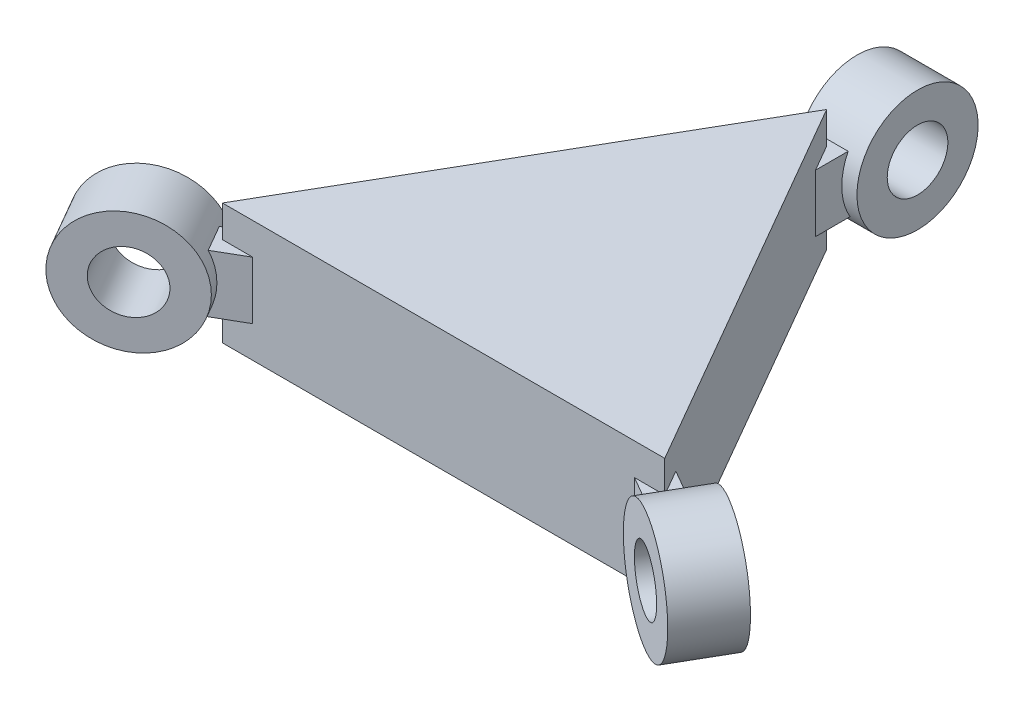
from build123d import *

# Parameters (mm, degrees)
BOSS_EXTRUDE1_DEPTH      = 20
BOSS_EXTRUDE2_DEPTH      = 5
BOSS_EXTRUDE2_DEPTH_BACK = 5
SKETCH3_R                = 10
SKETCH3_R_2              = 5
BOSS_EXTRUDE3_DEPTH      = 2.5
BOSS_EXTRUDE3_DEPTH_BACK = 2.5
SKETCH4_W                = 9.507770028
SKETCH4_H                = 1.347875139
MOVE_FACE1_BY            = 11.3
BODY_MOVE_COPY2_ANGLE    = 60
BODY_MOVE_COPY3_ANGLE    = 180


with BuildPart() as part:
    # Sketch1 → Boss-Extrude1 (new body)
    with BuildSketch(Plane(origin=(0, 0, 0), x_dir=(1, 0, 0), z_dir=(0, 1, 0))):
        Polygon((-36.5, 6.780145524), (36.5, 6.780145524), (0, 70), align=None)
    extrude(amount=BOSS_EXTRUDE1_DEPTH)


with BuildPart() as body_2:
    # Sketch3 → Boss-Extrude2 (new, two sides: drawn at the far end of the back side and taken through both)
    with BuildSketch(Plane(origin=(0, 0, 0), x_dir=(0, -1, 0), z_dir=(-1, 0, 0)).offset(-BOSS_EXTRUDE2_DEPTH_BACK)):
        with Locations(Location((-10.287349531, -80, 0), (0, 0, 90))):
            Circle(SKETCH3_R)
        with Locations(Location((-10.287349531, -80, 0), (0, 0, 90))):
            Circle(SKETCH3_R_2, mode=Mode.SUBTRACT)
    extrude(amount=BOSS_EXTRUDE2_DEPTH + BOSS_EXTRUDE2_DEPTH_BACK)

    # Sketch4 → Boss-Extrude3 (add, two sides: drawn at the far end of the back side and taken through both)
    with BuildSketch(Plane(origin=(0, 0, 0), x_dir=(0, -1, 0), z_dir=(-1, 0, 0)).offset(-BOSS_EXTRUDE3_DEPTH_BACK)):
        with Locations((-10, -70.673937569)):
            Rectangle(SKETCH4_W, SKETCH4_H)
    extrude(amount=BOSS_EXTRUDE3_DEPTH + BOSS_EXTRUDE3_DEPTH_BACK)

    # Move Face1: a face moved outward by 11.3
    extrude(body_2.faces().sort_by_distance((0, 10, -70))[0], amount=MOVE_FACE1_BY, dir=(0, 0, 1))


with BuildPart() as body_3:
    # Body-Move/Copy1: copy of body 2
    add(body_2.part.moved(Location((50, 0, 0))))


with BuildPart() as body_3_1:
    # Body-Move/Copy2: read off the stored shape, not the designer's step
    # Body-Move/Copy2: moved
    add(body_3.part.moved(Location((-25.8782217, 0, 45.4663337))).rotate(Axis((0, 0, 0), (0, 1, 0)), BODY_MOVE_COPY2_ANGLE))


with BuildPart() as body_3_2:
    # Body-Move/Copy3: moved
    add(body_3_1.part.rotate(Axis((-13.578099639, 0, -36.414437667), (0, 1, 0)), BODY_MOVE_COPY3_ANGLE))


with BuildPart() as body_3_3:
    # Body-Move/Copy4: moved
    add(body_3_2.part.moved(Location((60.621778265, 0, 35))))


with BuildPart() as body_3_4:
    # Body-Move/Copy5: read off the stored shape, not the designer's step
    # Body-Move/Copy5: moved
    add(body_3_3.part.moved(Location((-5.5290056, 0, -3.1921729))))


with BuildPart() as body_3_5:
    # Body-Move/Copy6: read off the stored shape, not the designer's step
    # Body-Move/Copy6: moved
    add(body_3_4.part.moved(Location((-0.625, 0, 1.0825318))))


with BuildPart() as body_4:
    # Mirror1: mirrored copy
    add(body_3_5.part.mirror(Plane.ZY))


with BuildPart() as part_1:
    add(part.part)

    # Combine1: union body 2, body 3, body 4
    add(body_2.part)
    add(body_3_5.part)
    add(body_4.part)


solid = part_1.part
